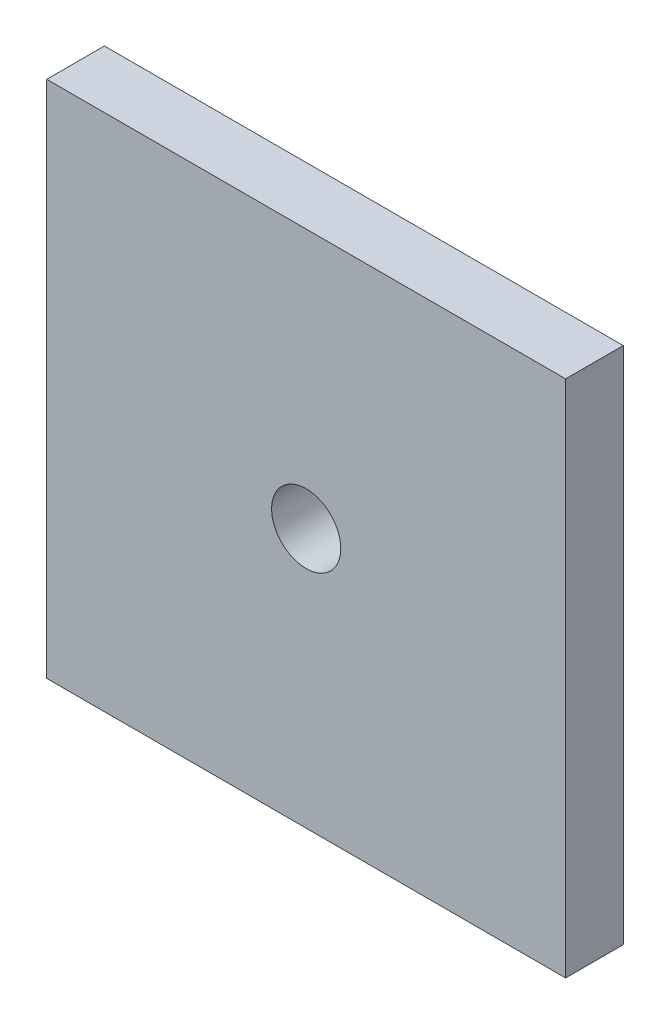
from build123d import *

# Parameters (mm, degrees)
SKETCH1_W           = 45
SKETCH1_H           = 45
SKETCH1_R           = 3
BOSS_EXTRUDE1_DEPTH = 5


with BuildPart() as part:
    # Sketch1 → Boss-Extrude1 (new body)
    with BuildSketch(Plane.XY):
        Rectangle(SKETCH1_W, SKETCH1_H)
        Circle(SKETCH1_R, mode=Mode.SUBTRACT)
    extrude(amount=BOSS_EXTRUDE1_DEPTH)


solid = part.part
